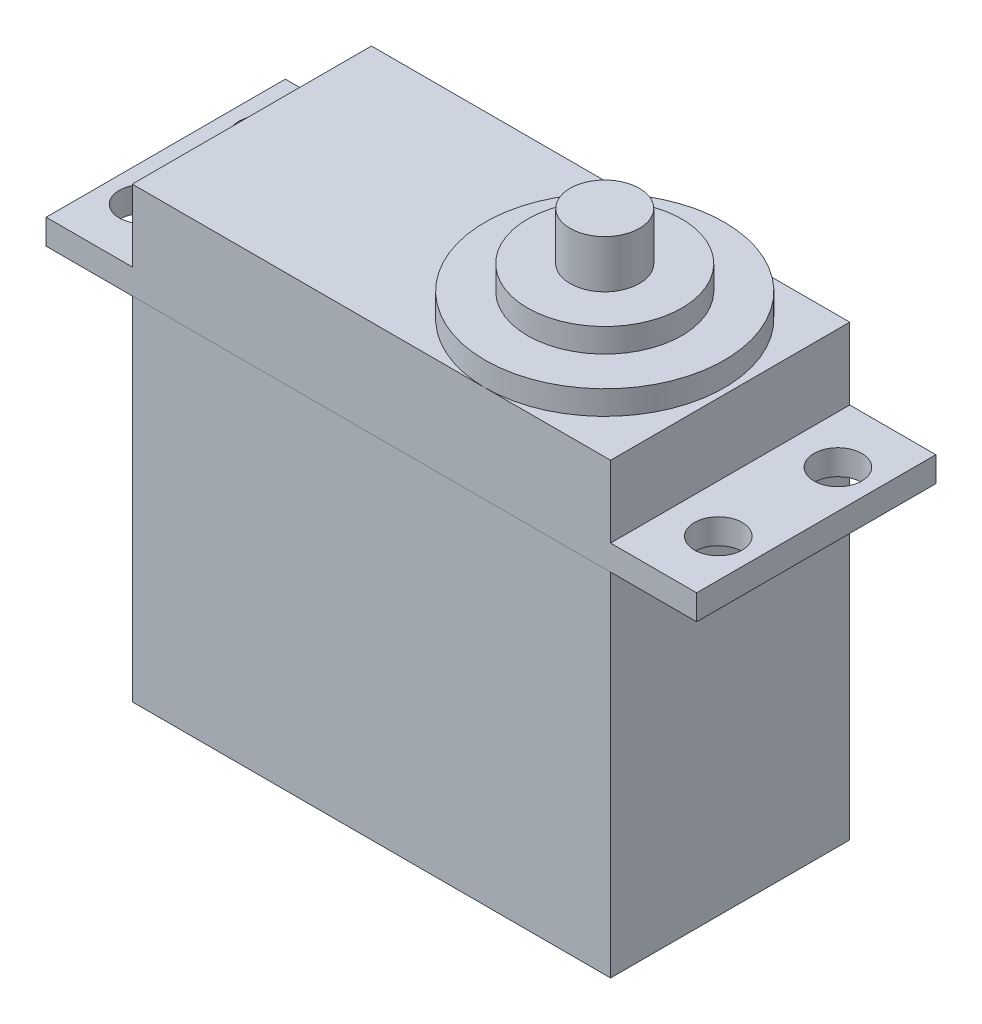
from build123d import *

# Parameters (mm, degrees)
CROQUIS1_W              = 40
CROQUIS1_H              = 20
SALIENTE_EXTRUIR1_DEPTH = 29.4
SALIENTE_EXTRUIR2_DEPTH = 2.1
CROQUIS3_R              = 2
CORTAR_EXTRUIR1_DEPTH   = 2.1
SALIENTE_EXTRUIR3_DEPTH = 6
CROQUIS5_R              = 10.001656383
SALIENTE_EXTRUIR4_DEPTH = 2
CROQUIS6_R              = 6.45
SALIENTE_EXTRUIR5_DEPTH = 2
CROQUIS7_R              = 2.9
SALIENTE_EXTRUIR6_DEPTH = 4


with BuildPart() as part:
    # Croquis1 → Saliente-Extruir1 (new body)
    with BuildSketch(Plane(origin=(0, 0, 0), x_dir=(1, 0, 0), z_dir=(0, 1, 0))):
        with Locations((20, -10)):
            Rectangle(CROQUIS1_W, CROQUIS1_H)
    extrude(amount=SALIENTE_EXTRUIR1_DEPTH)

    # Croquis2 → Saliente-Extruir2 (add)
    with BuildSketch(Plane(origin=(0, 29.4, 0), x_dir=(1, 0, 0), z_dir=(0, 1, 0))):
        Polygon((20, 0), (-7.2, 0), (-7.2, -20.003312767), (47.2, -20.003312767), (47.2, 0), align=None)
    extrude(amount=SALIENTE_EXTRUIR2_DEPTH)

    # Croquis3 → Cortar-Extruir1 (cut)
    with BuildSketch(Plane(origin=(0, 31.5, 0), x_dir=(1, 0, 0), z_dir=(0, 1, 0))):
        with Locations((-4.095776159, -5.000828192)):
            Circle(CROQUIS3_R)
        with Locations((-4.095776159, -15.002484575)):
            Circle(CROQUIS3_R)
        with Locations((44.010481376, -5.000828192)):
            Circle(CROQUIS3_R)
        with Locations((44.010481376, -15.002484575)):
            Circle(CROQUIS3_R)
    extrude(amount=-CORTAR_EXTRUIR1_DEPTH, mode=Mode.SUBTRACT)

    # Croquis4 → Saliente-Extruir3 (add)
    with BuildSketch(Plane(origin=(0, 31.5, 0), x_dir=(1, 0, 0), z_dir=(0, 1, 0))):
        Polygon((0, 0), (0, -20.003312767), (40.001626581, -20.003312767), (40, 0), align=None)
    extrude(amount=SALIENTE_EXTRUIR3_DEPTH)

    # Croquis5 → Saliente-Extruir4 (add)
    with BuildSketch(Plane(origin=(0, 37.5, 0), x_dir=(1, 0, 0), z_dir=(0, 1, 0))):
        with Locations((29.510368289, -10.001656383)):
            Circle(CROQUIS5_R)
    extrude(amount=SALIENTE_EXTRUIR4_DEPTH)

    # Croquis6 → Saliente-Extruir5 (add)
    with BuildSketch(Plane(origin=(0, 39.5, 0), x_dir=(1, 0, 0), z_dir=(0, 1, 0))):
        with Locations((29.510368289, -10.001656383)):
            Circle(CROQUIS6_R)
    extrude(amount=SALIENTE_EXTRUIR5_DEPTH)

    # Croquis7 → Saliente-Extruir6 (add)
    with BuildSketch(Plane(origin=(0, 41.5, 0), x_dir=(1, 0, 0), z_dir=(0, 1, 0))):
        with Locations((29.510368289, -10.001656383)):
            Circle(CROQUIS7_R)
    extrude(amount=SALIENTE_EXTRUIR6_DEPTH)


solid = part.part
